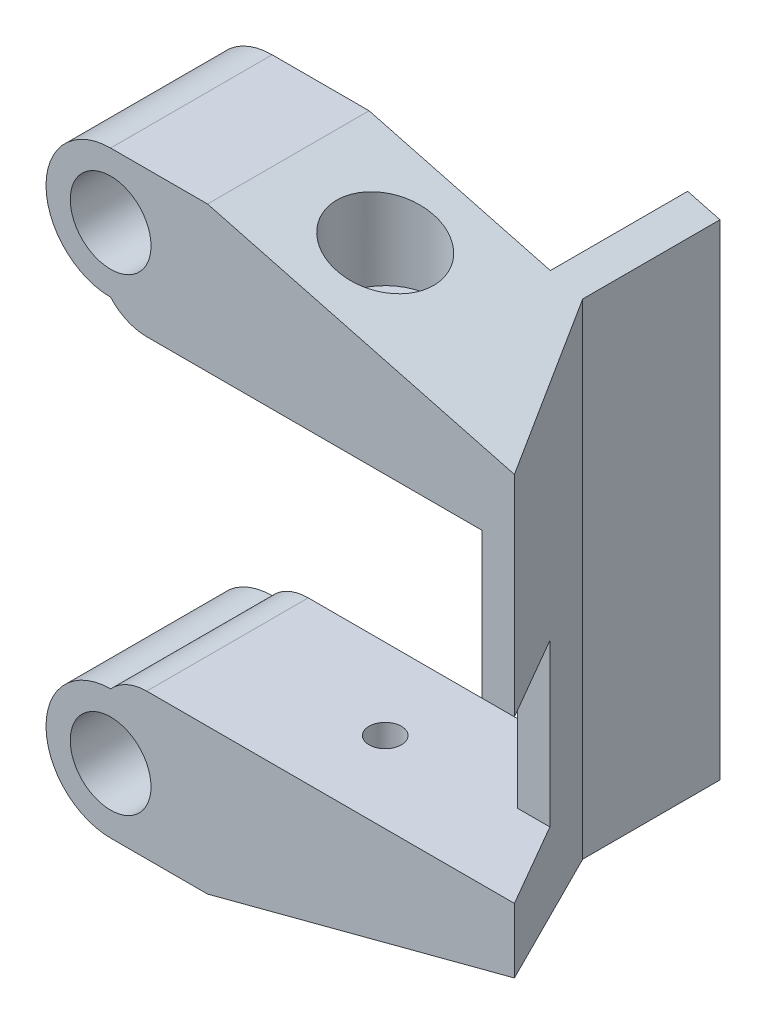
from build123d import *

# Parameters (mm, degrees)
CROQUIS1_R              = 2.5
SALIENTE_EXTRUIR1_DEPTH = 10
CROQUIS2_R              = 1
CORTAR_EXTRUIR1_DEPTH   = 4
SALIENTE_EXTRUIR2_DEPTH = 13.5
CROQUIS4_R              = 3
CORTAR_EXTRUIR2_DEPTH   = 1
SALIENTE_EXTRUIR3_START = 5
CROQUIS6_R              = 3
SALIENTE_EXTRUIR3_DEPTH = 5
CORTAR_EXTRUIR3_DEPTH   = 10
SALIENTE_EXTRUIR4_DEPTH = 8.5
CROQUIS5_W              = 2
CROQUIS5_H              = 10
CORTAR_EXTRUIR4_DEPTH   = 6
REDONDEO1_R             = 3


with BuildPart() as part:
    # Croquis1 → Saliente-Extruir1 (new body)
    with BuildSketch(Plane.XY):
        with BuildLine():
            Line((-106.231635218, 22.700651543), (-131.231635218, 22.700651543))
            Line((-131.231635218, 22.700651543), (-131.231635218, 21.700651543))
            ThreePointArc((-131.231635218, 21.700651543), (-135.231635218, 17.700651543), (-131.231635218, 13.700651543))
            Line((-131.231635218, 13.700651543), (-125.231635218, 13.700651543))
            Line((-125.231635218, 13.700651543), (-125.231635218, 18.700651543))
            Line((-125.231635218, 18.700651543), (-106.231635218, 18.700651543))
            Line((-106.231635218, 18.700651543), (-106.231635218, 22.700651543))
        make_face()
        with Locations((-131.231635218, 17.700651543)):
            Circle(CROQUIS1_R, mode=Mode.SUBTRACT)
    extrude(amount=SALIENTE_EXTRUIR1_DEPTH)

    # Croquis2 → Cortar-Extruir1 (cut)
    with BuildSketch(Plane.XZ.offset(-18.700651543)):
        with Locations(Location((-119.231635218, 5, 0), (0, 0, 270))):
            Circle(CROQUIS2_R)
        Polygon((-106.231635218, 0), (-106.231635218, 10), (-112.00513791, 0), align=None)
    extrude(amount=-CORTAR_EXTRUIR1_DEPTH, mode=Mode.SUBTRACT)

    # Croquis3 → Saliente-Extruir2 (add)
    with BuildSketch(Plane.XZ.offset(-18.700651543)):
        Polygon((-106.231635218, 10), (-108.231635218, 10), (-114.00513791, 0), (-112.00513791, 0), align=None)
    extrude(amount=-SALIENTE_EXTRUIR2_DEPTH)

    # Croquis4 → Cortar-Extruir2 (cut)
    with BuildSketch(Plane.XZ.offset(-18.700651543)):
        with Locations(Location((-119.231635218, 5, 0), (0, 0, 270))):
            Circle(CROQUIS4_R)
    extrude(amount=-CORTAR_EXTRUIR2_DEPTH, mode=Mode.SUBTRACT)

    # Croquis6 → Saliente-Extruir3 (add)
    with BuildSketch(Plane.XZ.offset(-18.700651543).offset(SALIENTE_EXTRUIR3_START)):
        Polygon((-106.231635218, 10), (-125.231635218, 10), (-125.231635218, 0), (-112.00513791, 0), align=None)
        with Locations(Location((-119.231635218, 5, 0), (0, 0, 270))):
            Circle(CROQUIS6_R, mode=Mode.SUBTRACT)
    extrude(amount=-SALIENTE_EXTRUIR3_DEPTH)

    # Croquis7 → Cortar-Extruir3 (cut)
    with BuildSketch(Plane.XY.offset(10)):
        Polygon((-106.231635218, 18.700651543), (-106.231635218, 13.700651543), (-125.231635218, 13.700651543), align=None)
    extrude(amount=-CORTAR_EXTRUIR3_DEPTH, mode=Mode.SUBTRACT)

    # Croquis8 → Saliente-Extruir4 (add)
    with BuildSketch(Plane(origin=(0, 0, 0), x_dir=(-1, 0, 0), z_dir=(0, 0, -1))):
        Polygon((112.00513791, 17.181308729), (112.00513791, 32.200651543), (114.00513791, 32.200651543), (114.00513791, 16.65499294), align=None)
    extrude(amount=SALIENTE_EXTRUIR4_DEPTH)

    # Simetría1: part across plane


with BuildPart() as part_1:
    add(part.part)
    add(part.part.mirror(Plane(origin=(0, 32.200651543, 0), x_dir=(0, 0, 1), z_dir=(0, -1, 0))))

    # Croquis5 → Cortar-Extruir4 (cut, along a direction that is not the sketch's normal)
    with BuildSketch(Plane.XY.offset(10)):
        with Locations((-107.231635218, 27.700651543)):
            Rectangle(CROQUIS5_W, CROQUIS5_H)
    extrude(amount=-CORTAR_EXTRUIR4_DEPTH, dir=(0.49999999999999506, 0, 0.8660254037844416), mode=Mode.SUBTRACT)

    # Redondeo1
    # the kernel refuses this fillet: 3 mm, written as the material it takes off along each edge
    with BuildSketch(Plane(origin=(-131.231635218, 41.700651543, -5.590169944), x_dir=(1, 0, 0), z_dir=(0, 0, 1))) as redondeo1_piece_1:
        with BuildLine():
            CenterArc((2.236067977, 3), REDONDEO1_R, 221.810314896, 48.189685104)
            Line((0, 1), (-0.04472136, 0.96))
            ThreePointArc((-0.04472136, 0.96), (-0.06, 0.5), (-0.06, 0))
            Line((-0.06, 0), (0, -0.06))
            Line((0, -0.06), (2.236067977, -0.06))
            Line((2.236067977, -0.06), (2.236067977, 0))
        make_face()
    extrude(amount=21.180339887, mode=Mode.SUBTRACT)
    with BuildSketch(Plane(origin=(-131.231635218, 22.700651543, -5.590169944), x_dir=(0, -1, 0), z_dir=(0, 0, 1))) as redondeo1_piece_2:
        with BuildLine():
            CenterArc((3, 2.236067977), REDONDEO1_R, 180, 48.189685104)
            Line((0, 2.236067977), (-0.06, 2.236067977))
            Line((-0.06, 2.236067977), (-0.06, 0))
            Line((-0.06, 0), (0, -0.06))
            ThreePointArc((0, -0.06), (0.5, -0.06), (0.96, -0.04472136))
            Line((0.96, -0.04472136), (1, 0))
        make_face()
    extrude(amount=21.180339887, mode=Mode.SUBTRACT)


solid = part_1.part
